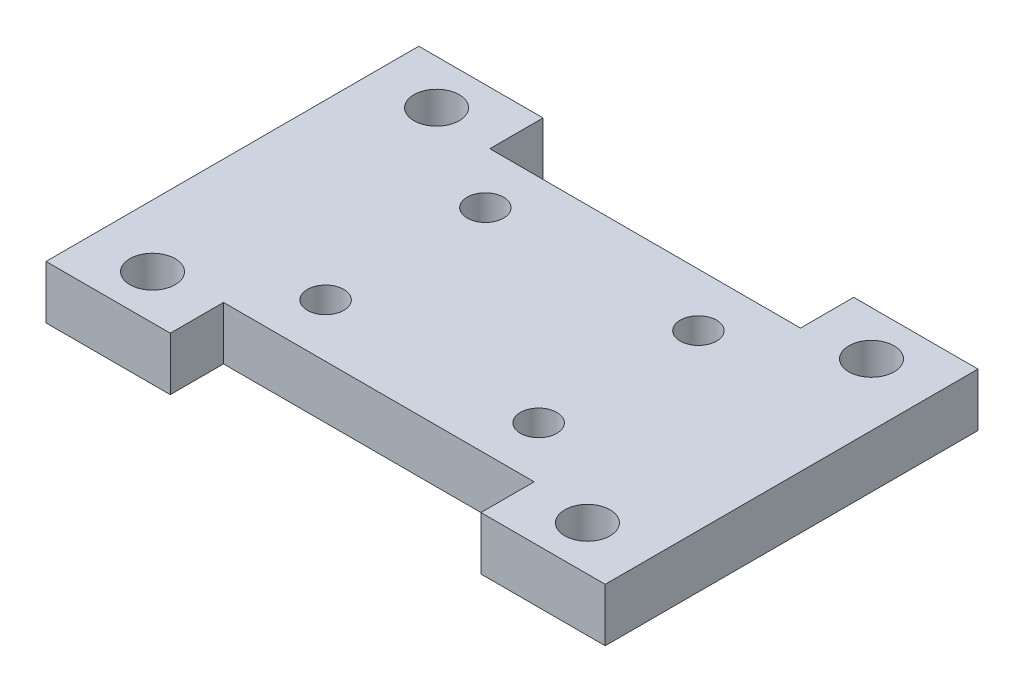
from build123d import *

# Parameters (mm, degrees)
SKETCH1_R           = 2.05
SKETCH1_R_2         = 2.55
BOSS_EXTRUDE1_DEPTH = 6


with BuildPart() as part:
    # Sketch1 → Boss-Extrude1 (new body)
    with BuildSketch(Plane(origin=(0, 0, 0), x_dir=(1, 0, 0), z_dir=(0, 1, 0))):
        Polygon((-17.5, -15), (17.5, -15), (17.5, -21), (31.5, -21), (31.5, 21), (17.5, 21), (17.5, 15), (-17.5, 15), (-17.5, 21), (-31.5, 21), (-31.5, -21), (-17.5, -21), align=None)
        with Locations((-12, 9)):
            Circle(SKETCH1_R, mode=Mode.SUBTRACT)
        with Locations((12, 9)):
            Circle(SKETCH1_R, mode=Mode.SUBTRACT)
        with Locations((12, -9)):
            Circle(SKETCH1_R, mode=Mode.SUBTRACT)
        with Locations((-12, -9)):
            Circle(SKETCH1_R, mode=Mode.SUBTRACT)
        with Locations((24.5, 16)):
            Circle(SKETCH1_R_2, mode=Mode.SUBTRACT)
        with Locations((24.5, -16)):
            Circle(SKETCH1_R_2, mode=Mode.SUBTRACT)
        with Locations((-24.5, -16)):
            Circle(SKETCH1_R_2, mode=Mode.SUBTRACT)
        with Locations((-24.5, 16)):
            Circle(SKETCH1_R_2, mode=Mode.SUBTRACT)
    extrude(amount=BOSS_EXTRUDE1_DEPTH)


solid = part.part
